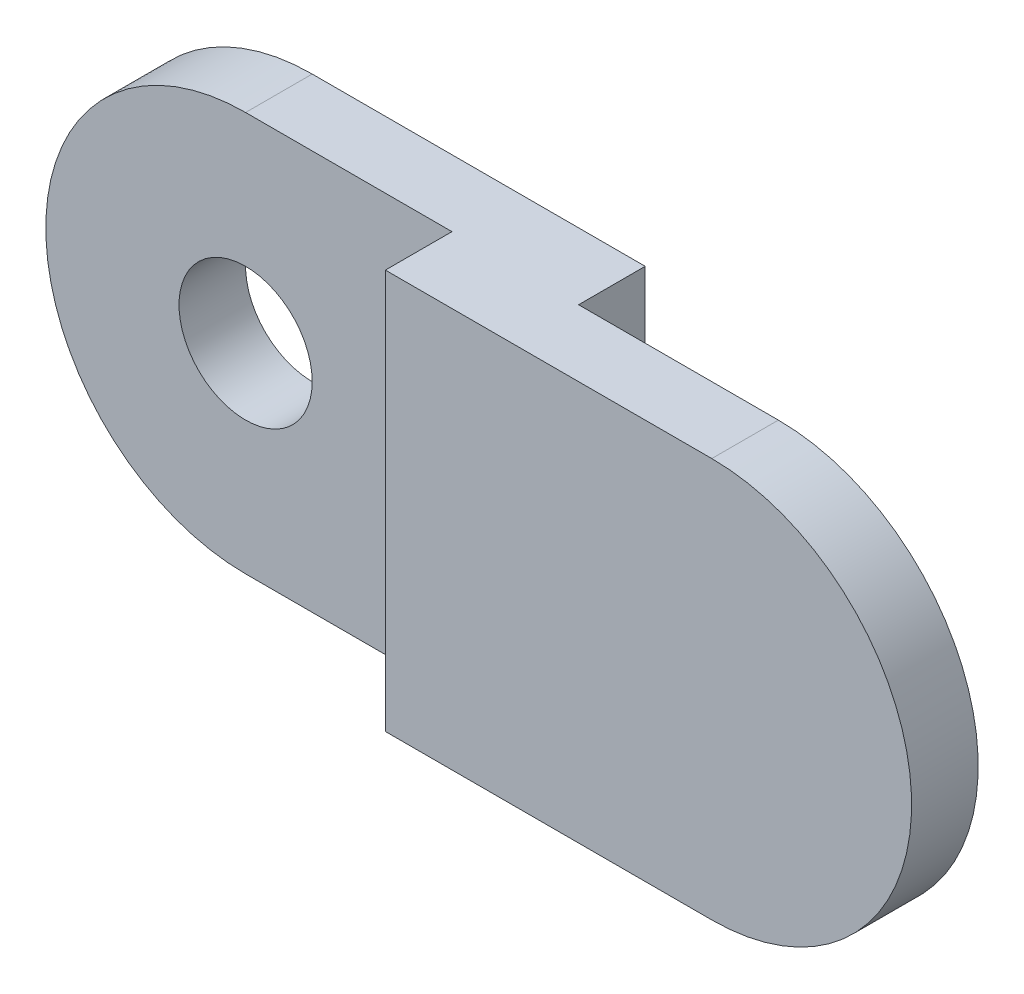
from build123d import *

# Parameters (mm, degrees)
BOSS_EXTRUDE1_DEPTH = 5
CUT_EXTRUDE2_DEPTH  = 2.5
CUT_EXTRUDE6_START  = -2.5
CUT_EXTRUDE6_DEPTH  = 2.5
SKETCH11_R          = 2.5
CUT_EXTRUDE7_DEPTH  = 2.5
SKETCH12_R          = 2.5
BOSS_EXTRUDE3_DEPTH = 2.5


with BuildPart() as part:
    # Sketch1 → Boss-Extrude1 (new body)
    with BuildSketch(Plane.XY):
        with BuildLine():
            ThreePointArc((-3.422374857, 0.826369029), (-1.760364695, 0.209518799), (0, 0))
            Line((0, 0), (20, 0))
            ThreePointArc((20, 0), (27.5, 7.5), (20, 15))
            Line((20, 15), (0, 15))
            ThreePointArc((0, 15), (-7.290481201, 9.260364695), (-3.422374857, 0.826369029))
        make_face()
    extrude(amount=BOSS_EXTRUDE1_DEPTH)

    # Sketch6 → Cut-Extrude2 (cut)
    with BuildSketch(Plane(origin=(0, 0, 0), x_dir=(-1, 0, 0), z_dir=(0, 0, -1))):
        with BuildLine():
            Line((-20, 15), (-12.5, 15))
            Line((-12.5, 15), (-12.5, 0))
            Line((-12.5, 0), (-20, 0))
            ThreePointArc((-20, 0), (-27.5, 7.5), (-20, 15))
        make_face()
    extrude(amount=-CUT_EXTRUDE2_DEPTH, mode=Mode.SUBTRACT)

    # Sketch7 → Cut-Extrude6 (cut)
    with BuildSketch(Plane.XY.offset(5).offset(CUT_EXTRUDE6_START)):
        with BuildLine():
            Line((7.746832871, 15), (0, 15))
            ThreePointArc((0, 15), (-7.5, 7.5), (0, 0))
            Line((0, 0), (5, 0))
            Line((5, 0), (7.746832871, 0))
            Line((7.746832871, 0), (7.746832871, 15))
        make_face()
    extrude(amount=CUT_EXTRUDE6_DEPTH, mode=Mode.SUBTRACT)

    # Sketch11 → Cut-Extrude7 (cut)
    with BuildSketch(Plane.XY.offset(2.5)):
        with Locations((0, 7.5)):
            Circle(SKETCH11_R)
    extrude(amount=-CUT_EXTRUDE7_DEPTH, mode=Mode.SUBTRACT)

    # Sketch12 → Boss-Extrude3 (add)
    with BuildSketch(Plane(origin=(0, 0, 2.5), x_dir=(-1, 0, 0), z_dir=(0, 0, -1))):
        with Locations((-20, 7.5)):
            Circle(SKETCH12_R)
    extrude(amount=BOSS_EXTRUDE3_DEPTH)


solid = part.part
